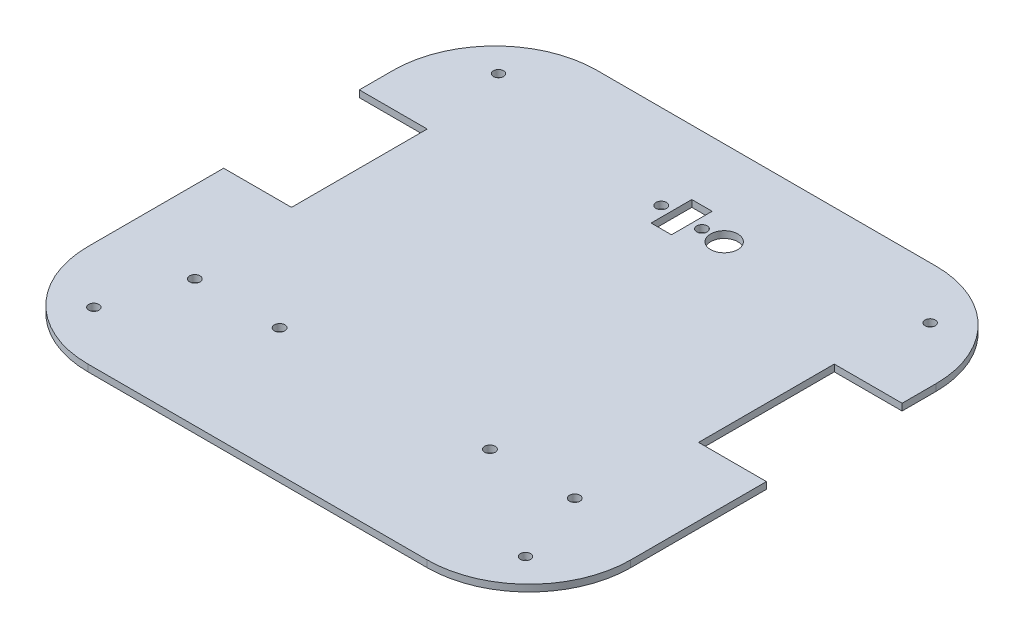
from build123d import *

# Parameters (mm, degrees)
SKETCH1_R           = 1.5
BOSS_EXTRUDE1_DEPTH = 2
SKETCH2_R           = 4
SKETCH2_R_2         = 1.55
SKETCH2_W           = 6
SKETCH2_H           = 12
CUT_EXTRUDE1_DEPTH  = 10
SKETCH3_R           = 1.55
CUT_EXTRUDE2_DEPTH  = 10


with BuildPart() as part:
    # Sketch1 → Boss-Extrude1 (new body)
    with BuildSketch(Plane(origin=(0, 0, 0), x_dir=(1, 0, 0), z_dir=(0, 1, 0))):
        with BuildLine():
            Line((-80, 35), (-60, 35))
            Line((-60, 35), (-60, -5))
            Line((-60, -5), (-80, -5))
            Line((-80, -5), (-80, -45))
            ThreePointArc((-80, -45), (-71.213203436, -66.213203436), (-50, -75))
            Line((-50, -75), (50, -75))
            ThreePointArc((50, -75), (71.213203436, -66.213203436), (80, -45))
            Line((80, -45), (80, -5))
            Line((80, -5), (60, -5))
            Line((60, -5), (60, 35))
            Line((60, 35), (80, 35))
            Line((80, 35), (80, 45))
            ThreePointArc((80, 45), (71.213203436, 66.213203436), (50, 75))
            Line((50, 75), (-50, 75))
            ThreePointArc((-50, 75), (-71.213203436, 66.213203436), (-80, 45))
            Line((-80, 45), (-80, 35))
        make_face()
        with Locations((-63.621027185, 59.644712986)):
            Circle(SKETCH1_R, mode=Mode.SUBTRACT)
        with Locations((63.621027185, 59.644712986)):
            Circle(SKETCH1_R, mode=Mode.SUBTRACT)
        with Locations((63.621027185, -59.644712986)):
            Circle(SKETCH1_R, mode=Mode.SUBTRACT)
        with Locations((-63.621027185, -59.644712986)):
            Circle(SKETCH1_R, mode=Mode.SUBTRACT)
    extrude(amount=BOSS_EXTRUDE1_DEPTH)

    # Sketch2 → Cut-Extrude1 (cut)
    with BuildSketch(Plane(origin=(0, 2, 0), x_dir=(1, 0, 0), z_dir=(0, 1, 0))):
        with Locations((12.55, 50)):
            Circle(SKETCH2_R)
        with Locations((6, 50)):
            Circle(SKETCH2_R_2)
        with Locations((0, 50)):
            Rectangle(SKETCH2_W, SKETCH2_H)
        with Locations((-6, 50)):
            Circle(SKETCH2_R_2)
    extrude(amount=-CUT_EXTRUDE1_DEPTH, mode=Mode.SUBTRACT)

    # Sketch3 → Cut-Extrude2 (cut)
    with BuildSketch(Plane(origin=(0, 2, 0), x_dir=(1, 0, 0), z_dir=(0, 1, 0))):
        with Locations((-56, -37.5)):
            Circle(SKETCH3_R)
        with Locations((-31, -37.5)):
            Circle(SKETCH3_R)
        with Locations((31, -37.5)):
            Circle(SKETCH3_R)
        with Locations((56, -37.5)):
            Circle(SKETCH3_R)
    extrude(amount=-CUT_EXTRUDE2_DEPTH, mode=Mode.SUBTRACT)


solid = part.part
